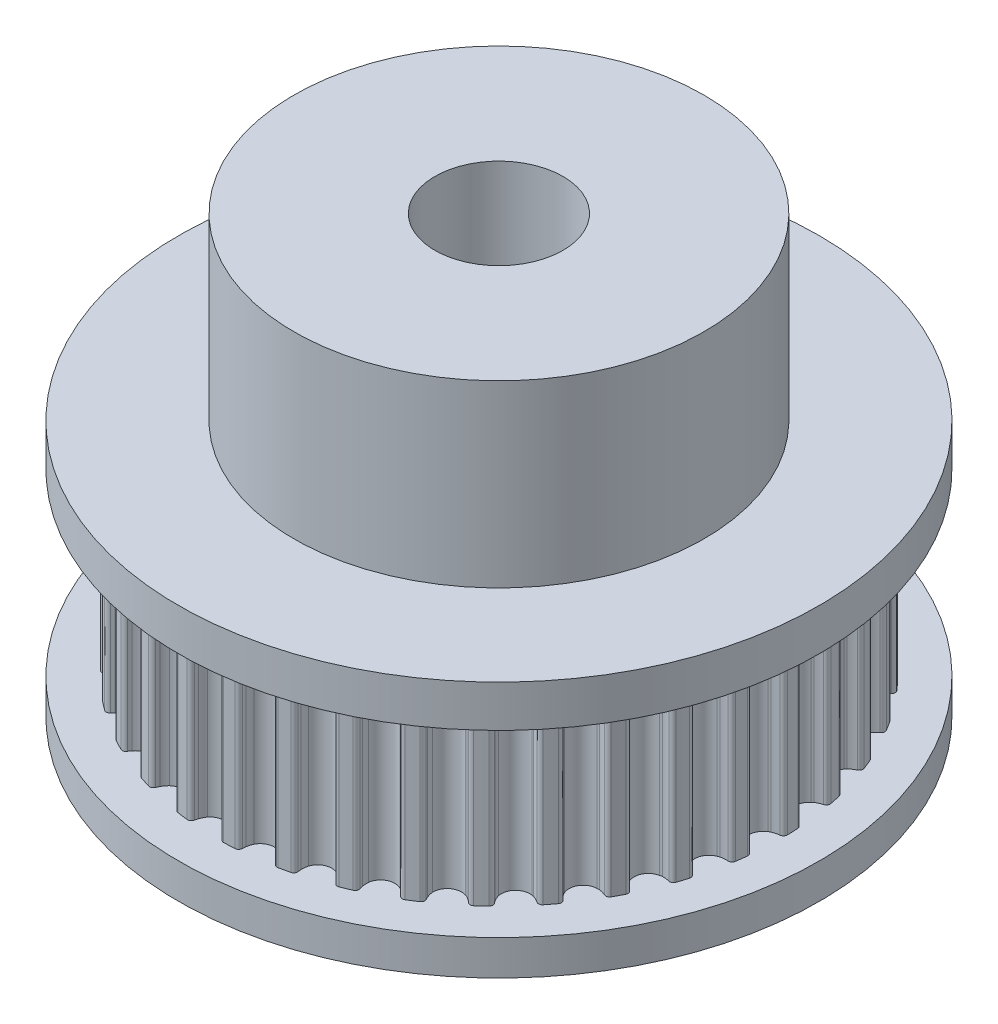
from build123d import *

# Parameters (mm, degrees)
CUT_EXTRUDE1_DEPTH       = 7
FILLET4_R                = 0.15
CIRPATTERN1_COUNT        = 36
FILLET4_OF_CIRPATTERN1_R = 0.15


with BuildPart() as part:
    # Sketch1 → Revolve1 (revolve)
    with BuildSketch(Plane.XY, mode=Mode.PRIVATE) as revolve1_sk:
        Polygon((2.5, 0), (12.5, 0), (12.5, 1.367406231), (11, 1.367406231), (11, 8.367406231), (12.5, 8.367406231), (12.5, 10), (8, 10), (8, 17), (2.5, 17), align=None)
    revolve(revolve1_sk.sketch.rotate(Axis((0, 0, 0), (0, 1, 0)), 90), axis=Axis((0, 0, 0), (0, 1, 0)))

    # Sketch5 → Cut-Extrude1 (cut)
    with BuildSketch(Plane(origin=(0, 8.367406231, 0), x_dir=(-1, 0, 0), z_dir=(0, -1, 0))):
        with BuildLine():
            ThreePointArc((8.497978042, 6.984580818), (8.459754271, 7.030829089), (8.421278808, 7.07686818))
            ThreePointArc((8.421278808, 7.07686818), (8.104574962, 7.437463592), (7.772443597, 7.78390137))
            ThreePointArc((7.772443597, 7.78390137), (7.729745975, 7.826303544), (7.686817034, 7.868471509))
            ThreePointArc((7.686817034, 7.868471509), (7.596052155, 7.771579695), (7.518922574, 7.663518071))
            ThreePointArc((7.518922574, 7.663518071), (7.458654688, 7.5485093), (7.415216531, 7.426147696))
            ThreePointArc((7.415216531, 7.426147696), (7.55487466, 6.927324386), (8.045469786, 6.761054992))
            ThreePointArc((8.045469786, 6.761054992), (8.089563027, 6.76597239), (8.133014304, 6.774937948))
            ThreePointArc((8.133014304, 6.774937948), (8.326650653, 6.860340736), (8.497978042, 6.984580818))
        make_face()
    cut_extrude1 = extrude(amount=CUT_EXTRUDE1_DEPTH, mode=Mode.SUBTRACT)

    # Fillet4
    fillet4_edges = [part.edges().sort_by_distance(p)[0] for p in [
        (-8.497978042, 4.867406231, -6.984580818),
        (-7.686817034, 4.867406231, -7.868471509),
    ]]
    fillet(fillet4_edges, radius=FILLET4_R)

    # CirPattern1: Cut-Extrude1 ×36 about axis
    cirpattern1_axis = Axis((0, 0, 0), (0, 1, 0))
    for i in range(1, CIRPATTERN1_COUNT):
        add(cut_extrude1.rotate(cirpattern1_axis, i * 360 / CIRPATTERN1_COUNT), mode=Mode.SUBTRACT)

    # Fillet4 of CirPattern1
    fillet4_of_cirpattern1_edges = [part.edges().sort_by_distance(p)[0] for p in [
        (-9.581734391, 4.867406231, -5.40281094),
        (-8.93638275, 4.867406231, -6.414129976),
        (-10.37435459, 4.867406231, -3.656879386),
        (-9.914420998, 4.867406231, -4.76489835),
        (-10.851755274, 4.867406231, -1.799835402),
        (-10.59121458, 4.867406231, -2.970887698),
        (-10.999430865, 4.867406231, 0.11189567),
        (-10.946199467, 4.867406231, -1.086608128),
        (-10.812894316, 4.867406231, 2.020226848),
        (-10.968589623, 4.867406231, 0.830687481),
        (-10.297813444, 4.867406231, 3.867174456),
        (-10.657704733, 4.867406231, 2.722743071),
        (-9.469838722, 4.867406231, 5.596619925),
        (-10.022990877, 4.867406231, 4.532069491),
        (-8.354127742, 4.867406231, 7.15601493),
        (-9.083733516, 4.867406231, 6.203691273),
        (-6.984580818, 4.867406231, 8.497978042),
        (-7.868471509, 4.867406231, 7.686817034),
        (-5.40281094, 4.867406231, 9.581734391),
        (-6.414129976, 4.867406231, 8.93638275),
        (-3.656879386, 4.867406231, 10.37435459),
        (-4.76489835, 4.867406231, 9.914420998),
        (-1.799835402, 4.867406231, 10.851755274),
        (-2.970887698, 4.867406231, 10.59121458),
        (0.11189567, 4.867406231, 10.999430865),
        (-1.086608128, 4.867406231, 10.946199467),
        (2.020226848, 4.867406231, 10.812894316),
        (0.830687481, 4.867406231, 10.968589623),
        (3.867174456, 4.867406231, 10.297813444),
        (2.722743071, 4.867406231, 10.657704733),
        (5.596619925, 4.867406231, 9.469838722),
        (4.532069491, 4.867406231, 10.022990877),
        (7.15601493, 4.867406231, 8.354127742),
        (6.203691273, 4.867406231, 9.083733516),
        (8.497978042, 4.867406231, 6.984580818),
        (7.686817034, 4.867406231, 7.868471509),
        (9.581734391, 4.867406231, 5.40281094),
        (8.93638275, 4.867406231, 6.414129976),
        (10.37435459, 4.867406231, 3.656879386),
        (9.914420998, 4.867406231, 4.76489835),
        (10.851755274, 4.867406231, 1.799835402),
        (10.59121458, 4.867406231, 2.970887698),
        (10.999430865, 4.867406231, -0.11189567),
        (10.946199467, 4.867406231, 1.086608128),
        (10.812894316, 4.867406231, -2.020226848),
        (10.968589623, 4.867406231, -0.830687481),
        (10.297813444, 4.867406231, -3.867174456),
        (10.657704733, 4.867406231, -2.722743071),
        (9.469838722, 4.867406231, -5.596619925),
        (10.022990877, 4.867406231, -4.532069491),
        (8.354127742, 4.867406231, -7.15601493),
        (9.083733516, 4.867406231, -6.203691273),
        (6.984580818, 4.867406231, -8.497978042),
        (7.868471509, 4.867406231, -7.686817034),
        (5.40281094, 4.867406231, -9.581734391),
        (6.414129976, 4.867406231, -8.93638275),
        (3.656879386, 4.867406231, -10.37435459),
        (4.76489835, 4.867406231, -9.914420998),
        (1.799835402, 4.867406231, -10.851755274),
        (2.970887698, 4.867406231, -10.59121458),
        (-0.11189567, 4.867406231, -10.999430865),
        (1.086608128, 4.867406231, -10.946199467),
        (-2.020226848, 4.867406231, -10.812894316),
        (-0.830687481, 4.867406231, -10.968589623),
        (-3.867174456, 4.867406231, -10.297813444),
        (-2.722743071, 4.867406231, -10.657704733),
        (-5.596619925, 4.867406231, -9.469838722),
        (-4.532069491, 4.867406231, -10.022990877),
        (-7.15601493, 4.867406231, -8.354127742),
        (-6.203691273, 4.867406231, -9.083733516),
    ]]
    fillet(fillet4_of_cirpattern1_edges, radius=FILLET4_OF_CIRPATTERN1_R)


solid = part.part
